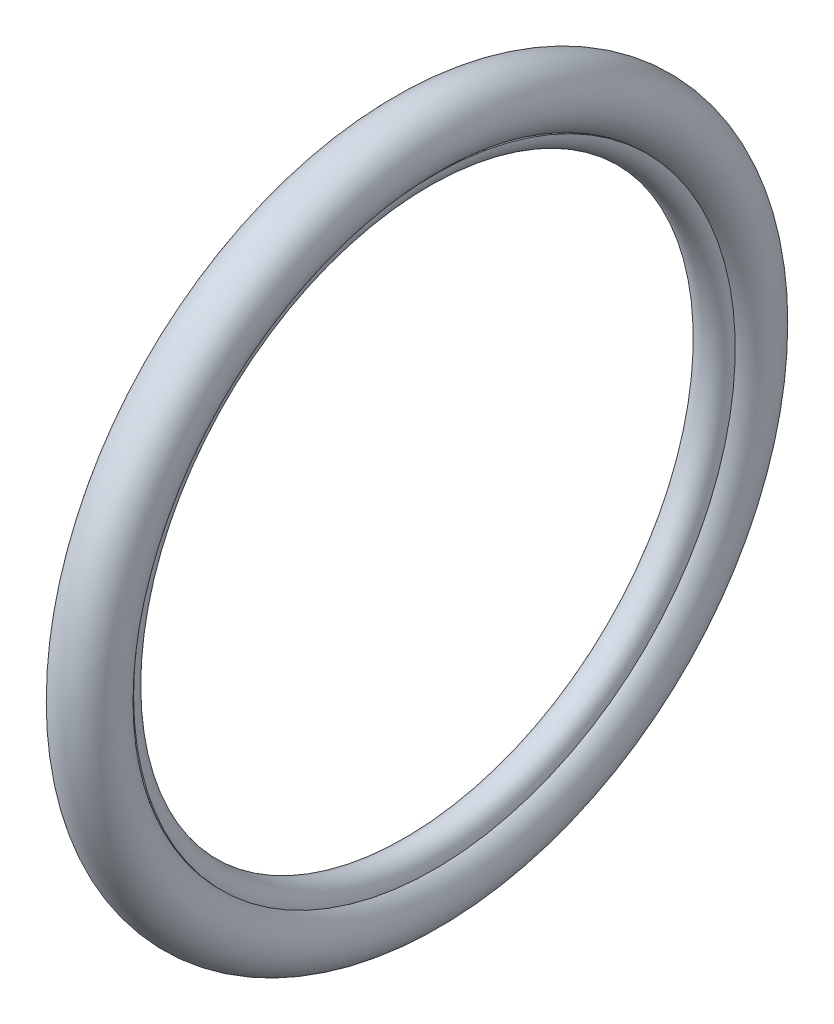
from build123d import *

# Parameters (mm, degrees)
SKETCH3_R = 31.75


with BuildPart() as part:
    # Sketch2 → Revolve1 (revolve)
    with BuildSketch(Plane.XY):
        with BuildLine():
            Line((-18, 311), (-16, 311))
            ThreePointArc((-16, 311), (0, 295), (16, 311))
            Line((16, 311), (18, 311))
            ThreePointArc((18, 311), (0, 293), (-18, 311))
        make_face()
    revolve(axis=Axis((-71, 0, 0), (1, 0, 0)))


with BuildPart() as body_2:
    # Sketch3 → Revolve2 (revolve)
    with BuildSketch(Plane.XY):
        with Locations((0, 338.423757948)):
            Circle(SKETCH3_R)
    revolve(axis=Axis((-71, 0, 0), (1, 0, 0)))


solid = Compound([part.part, body_2.part])
